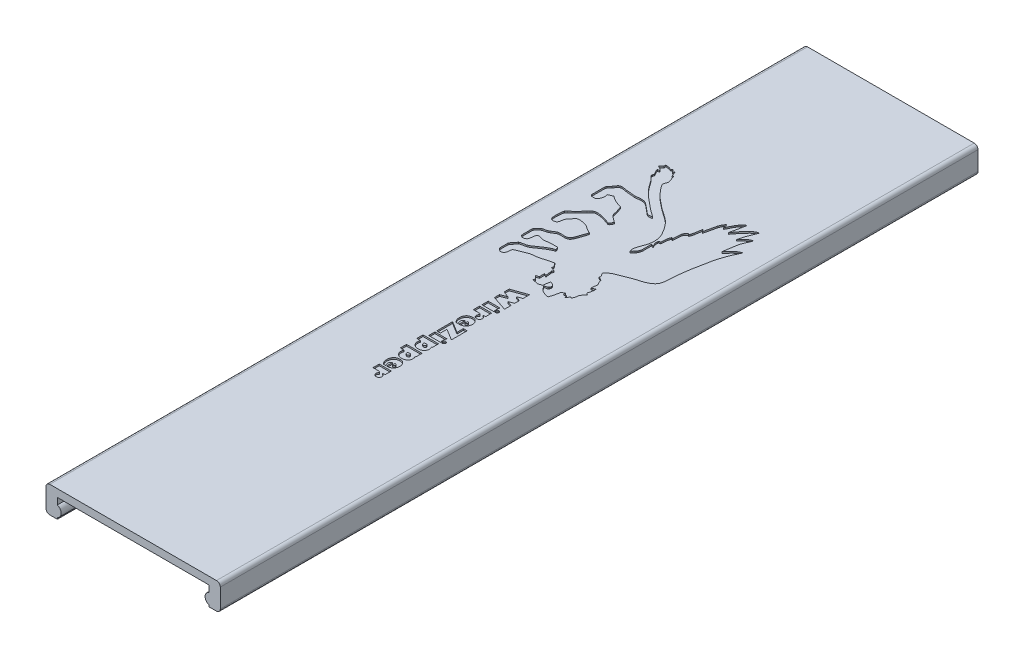
from build123d import *

# Parameters (mm, degrees)
BOSS_EXTRUDE1_DEPTH = 100
CUT_EXTRUDE1_DEPTH  = 0.2
CUT_EXTRUDE3_DEPTH  = 0.2


with BuildPart() as part:
    # Sketch1 → Boss-Extrude1 (new body)
    with BuildSketch(Plane.XY):
        with BuildLine():
            Line((21.5, 0), (22.5, 0))
            ThreePointArc((22.5, 0), (22.853553391, 0.146446609), (23, 0.5))
            Line((23, 0.5), (23, 3))
            ThreePointArc((23, 3), (22.853553391, 3.353553391), (22.5, 3.5))
            Line((22.5, 3.5), (0.5, 3.5))
            ThreePointArc((0.5, 3.5), (0.146446609, 3.353553391), (0, 3))
            Line((0, 3), (0, 0.5))
            ThreePointArc((0, 0.5), (0.146446609, 0.146446609), (0.5, 0))
            Line((0.5, 0), (1.5, 0))
            Line((1.5, 0), (1.5, 0.22281926))
            ThreePointArc((1.5, 0.22281926), (2, 0.929926042), (1.5, 1.637032823))
            Line((1.5, 1.637032823), (1.5, 2.5))
            Line((1.5, 2.5), (21.5, 2.5))
            Line((21.5, 2.5), (21.5, 1.637032823))
            ThreePointArc((21.5, 1.637032823), (21, 0.929926042), (21.5, 0.22281926))
            Line((21.5, 0.22281926), (21.5, 0))
        make_face()
    extrude(amount=BOSS_EXTRUDE1_DEPTH)

    # Sketch2 → Cut-Extrude1 (cut)
    with BuildSketch(Plane(origin=(0, 3.5, -40.204004893), x_dir=(1, 0, 0), z_dir=(0, 1, 0))):
        Polygon((19.745567043, -68.104601105), (19.771329957, -68.016192319), (19.70560115, -68.038746064), (19.64138336, -68.063779757), (19.578619421, -68.091182355), (19.517252165, -68.120842815), (19.457224424, -68.152650096), (19.39847903, -68.186493155), (19.340958816, -68.22226095), (19.284606615, -68.25984244), (19.229365259, -68.299126581), (19.175177579, -68.340002332), (19.12198641, -68.382358651), (19.069734583, -68.426084496), (19.018364931, -68.471068823), (18.918043479, -68.564368759), (18.772748422, -68.710981234), (18.269777505, -69.271361386), (18.281217218, -69.152948654), (18.534959056, -67.569138215), (18.544005901, -67.509503112), (18.554730191, -67.450416977), (18.56703761, -67.391848979), (18.580833842, -67.333768285), (18.612515474, -67.218945481), (18.649020551, -67.105701905), (18.711171581, -66.93825803), (19.047435047, -66.172036884), (19.133726594, -65.94994016), (19.076628488, -65.960005663), (19.0210055, -65.972912087), (18.966794939, -65.988522881), (18.913934115, -66.006701499), (18.862360336, -66.027311391), (18.812010911, -66.05021601), (18.762823149, -66.075278807), (18.71473436, -66.102363235), (18.667681851, -66.131332743), (18.621602933, -66.162050786), (18.576434914, -66.194380813), (18.532115103, -66.228186277), (18.445769342, -66.299677323), (18.362064121, -66.375431536), (18.200569188, -66.535359923), (17.84770658, -66.896305725), (17.884657267, -66.736955957), (17.968344054, -66.421133138), (18.063839559, -66.108907692), (18.225973101, -65.646689184), (18.633040198, -64.666178627), (18.599411796, -64.669771971), (18.533227498, -64.680575674), (18.468456628, -64.695924518), (18.405079291, -64.715485446), (18.312582633, -64.751995932), (18.2231095, -64.796110162), (18.080524168, -64.883478066), (17.794211119, -65.113398916), (17.069099288, -65.909145003), (16.828722484, -66.241607928), (16.513006588, -66.656341035), (16.794160411, -65.369006265), (16.941861286, -64.59631034), (16.870777867, -64.636264025), (16.802816891, -64.679249232), (16.737833191, -64.725113573), (16.675681599, -64.773704659), (16.616216947, -64.824870101), (16.559294067, -64.87845751), (16.504767792, -64.934314498), (16.452492954, -64.992288676), (16.402324385, -65.052227654), (16.354116917, -65.113979045), (16.307725383, -65.177390459), (16.263004615, -65.242309509), (16.219809445, -65.308583804), (16.177994705, -65.376060956), (16.097925845, -65.514014276), (15.98454659, -65.726155966), (15.693970925, -66.293387042), (15.617711182, -66.428936729), (15.54903134, -65.848423204), (15.522460267, -65.865064365), (15.472343148, -65.901302245), (15.426048379, -65.941194805), (15.383322735, -65.984398764), (15.34391299, -66.030570845), (15.290461754, -66.104643271), (15.228435653, -66.210590997), (15.076480483, -66.580017015), (15.040869472, -66.693542611), (14.686293126, -68.258406048), (14.474940792, -67.937489416), (14.445551284, -68.104829917), (14.310577684, -68.947591988), (14.271183579, -69.113223294), (14.240015457, -69.222374291), (14.204192452, -69.330305289), (14.163088355, -69.436841345), (14.140360206, -69.489531601), (14.116076957, -69.541807517), (13.981394714, -69.409464834), (13.758050972, -69.632820298), (13.676716055, -69.754194358), (13.642544144, -69.830846835), (13.624269592, -69.89243466), (13.614813809, -69.932350891), (13.591969798, -70.052722709), (13.568864821, -70.255035201), (13.529664818, -71.070500793), (13.334094675, -70.96058259), (13.302168255, -71.042533388), (13.24802945, -71.209136729), (13.206156478, -71.378791597), (13.169809605, -71.594144463), (13.14752875, -71.855680811), (13.149463132, -72.206015635), (12.963703448, -72.245338409), (12.919499216, -72.274044131), (12.898916729, -72.298983789), (12.888280793, -72.319488077), (12.880455427, -72.34346579), (12.874040289, -72.372947136), (12.865584292, -72.431757942), (12.862523692, -72.490347444), (12.864334122, -72.548693093), (12.870491214, -72.606772342), (12.893747912, -72.722041444), (13.055767611, -73.167952174), (12.76260984, -73.058920113), (12.772836021, -74.2235194), (12.769441063, -74.267985594), (12.764247026, -74.311940293), (12.757306122, -74.355374587), (12.748670559, -74.398279565), (12.738392549, -74.440646318), (12.7265243, -74.482465934), (12.713118023, -74.523729503), (12.698225927, -74.564428116), (12.681900222, -74.604552862), (12.664193119, -74.644094829), (12.624843556, -74.721394791), (12.580594918, -74.796256719), (12.531864882, -74.868609329), (12.479071129, -74.938381339), (12.422631337, -75.005501468), (12.332049001, -75.10105345), (12.235612524, -75.190237731), (12.134731573, -75.272813733), (12.046286421, -74.820815745), (12.0572263, -74.751406038), (12.070060076, -74.682497303), (12.08463885, -74.614050506), (12.100813721, -74.546026613), (12.137356163, -74.411091404), (12.200418082, -74.210884521), (12.455179307, -73.483307548), (12.495149159, -73.349414391), (12.530187067, -73.214246266), (12.545484294, -73.146086506), (12.559101837, -73.077490902), (12.570890798, -73.008420419), (12.580702278, -72.938836025), (12.588387376, -72.868698685), (12.59464246, -72.810642899), (12.603824389, -72.694131792), (12.608519809, -72.577268101), (12.608670092, -72.460267982), (12.604216612, -72.343347591), (12.595100741, -72.226723086), (12.581263852, -72.110610622), (12.562647316, -71.995226355), (12.539192508, -71.880786442), (12.510840798, -71.767507038), (12.47753356, -71.655604302), (12.439212167, -71.545294387), (12.39581799, -71.436793452), (12.347292403, -71.330317652), (12.293576778, -71.226083144), (12.153611462, -70.972593632), (12.055622325, -70.8055721), (11.953676271, -70.640627802), (11.847590064, -70.478189353), (11.737180466, -70.318685371), (11.622264242, -70.162544472), (11.563058883, -70.085869122), (11.502658155, -70.010195274), (11.441039151, -69.935576505), (11.378178968, -69.862066392), (11.314054701, -69.789718512), (11.248643446, -69.718586443), (11.181922298, -69.648723762), (11.113868352, -69.580184045), (11.044458704, -69.513020869), (10.973670449, -69.447287813), (10.901480682, -69.383038452), (10.8278665, -69.320326365), (10.752804998, -69.259205127), (10.676273271, -69.199728316), (10.598248414, -69.14194951), (10.518707523, -69.085922285), (9.445158783, -68.330045283), (9.377323265, -68.286704215), (8.529964041, -67.61150044), (8.336111467, -67.454739788), (8.147528972, -67.291868199), (7.90408908, -67.065842996), (7.669551492, -66.830496664), (7.443649508, -66.586710778), (7.173009545, -66.271453322), (6.864769026, -65.879980377), (6.709729802, -65.656858788), (6.656644684, -65.543795663), (6.640724685, -65.474324633), (6.637953976, -65.419306649), (6.637039488, -65.393399508), (6.637876621, -65.367752405), (6.640315856, -65.342344663), (6.649402561, -65.292164545), (6.663103453, -65.24269372), (6.767484106, -64.975890107), (6.787730528, -64.902361955), (6.795283594, -64.852609955), (6.796828208, -64.827451949), (6.796685517, -64.802078367), (6.794706002, -64.77646853), (6.790740146, -64.75060176), (6.78463843, -64.724457376), (6.776251336, -64.698014701), (6.478949583, -63.833852049), (6.316198754, -63.871944585), (6.081407246, -63.266668763), (5.943714714, -63.442255947), (5.617870925, -63.080333737), (5.499302591, -63.247135679), (5.418185032, -63.212665539), (5.083167801, -63.109789756), (4.852038362, -63.078852692), (4.675548278, -63.079290725), (4.667182278, -63.332341528), (4.3028609, -63.683744915), (4.436380901, -63.74543469), (4.682235799, -63.862000094), (4.740558774, -63.903978471), (4.775654331, -63.93618192), (4.807122862, -63.972386928), (4.821336845, -63.992158035), (4.834451894, -64.013131153), (4.846403949, -64.035373491), (4.857128952, -64.058952255), (4.866562843, -64.083934652), (4.619415738, -64.138096574), (4.636424293, -64.21830065), (4.696572924, -64.397852828), (4.954743423, -64.842439101), (4.882509129, -65.057092669), (4.880850914, -65.175763412), (4.901269108, -65.22048276), (4.962643763, -65.325273315), (5.32889596, -65.714175511), (5.354305854, -65.737196295), (5.426177903, -65.809786685), (5.534157903, -65.940347595), (5.924220438, -66.497400316), (5.994118086, -66.591179891), (6.065464319, -66.683663429), (6.138209009, -66.774888771), (6.212302028, -66.86489376), (6.287693249, -66.953716237), (6.364332545, -67.041394044), (6.442169787, -67.127965023), (6.521154849, -67.213467015), (6.601237603, -67.297937861), (6.764495676, -67.463937487), (6.931542986, -67.626266632), (7.101978513, -67.785228032), (7.275401236, -67.94112442), (7.540259084, -68.169884333), (8.356211579, -68.829090573), (8.39965809, -68.870721216), (8.488690302, -68.951152824), (8.626852738, -69.065704523), (8.914944993, -69.279321314), (9.595664905, -69.767475131), (9.73351794, -69.882958951), (9.238387712, -69.912079265), (9.122579566, -69.898059871), (9.054333719, -69.880159565), (8.905920839, -69.767554214), (7.90154777, -68.93355232), (7.651348823, -68.749684369), (7.602203888, -68.718777787), (7.552316259, -68.691274341), (7.501727456, -68.667008821), (7.450479005, -68.645816018), (7.398612426, -68.627530719), (7.346169242, -68.611987715), (7.293190978, -68.599021796), (7.239719154, -68.588467749), (7.185795294, -68.580160366), (7.13146092, -68.573934435), (7.076757555, -68.569624746), (7.021726722, -68.567066089), (6.910848742, -68.566541025), (6.743113827, -68.5747559), (6.185203457, -68.626466799), (6.076335393, -68.631387665), (4.991956592, -68.53259847), (4.861058435, -68.514729341), (4.366578875, -68.439300904), (4.267682616, -68.437779177), (4.201866854, -68.441828587), (4.136175391, -68.450643686), (4.070635862, -68.464836967), (4.037931708, -68.474141829), (4.01404608, -68.482781016), (3.991237496, -68.492646738), (3.969449153, -68.503673451), (3.92870599, -68.528947679), (3.891362185, -68.558079357), (3.856963332, -68.590544139), (3.780868317, -68.68284742), (3.574977655, -68.983157009), (3.510176489, -69.065065577), (3.25557439, -69.337636123), (3.211351075, -69.401747679), (3.186726578, -69.44712548), (3.166822765, -69.495060225), (3.158864646, -69.520106327), (3.152354934, -69.545935514), (3.147383041, -69.572595737), (3.14403838, -69.600134946), (3.139952782, -69.65652541), (3.140584749, -71.23861477), (3.144107239, -71.277524794), (3.183718199, -71.405349389), (3.229265505, -71.469694649), (3.269232129, -71.502636865), (3.304427669, -71.520476277), (3.344216436, -71.53134745), (3.61837653, -71.551970824), (3.709675015, -71.543297562), (3.775331899, -71.528081984), (3.817132856, -71.512976279), (3.856966272, -71.493394454), (3.894496742, -71.468902338), (3.91229356, -71.454679244), (3.929388866, -71.439065763), (3.945740734, -71.422007625), (3.961307239, -71.403450559), (3.98937849, -71.373627764), (4.015892902, -71.342811256), (4.040860808, -71.311051795), (4.064292537, -71.278400145), (4.086198421, -71.244907065), (4.106588791, -71.210623319), (4.125473977, -71.175599669), (4.142864311, -71.139886875), (4.158770122, -71.1035357), (4.173201743, -71.066596906), (4.186169503, -71.029121254), (4.197683734, -70.991159506), (4.207754767, -70.952762424), (4.216392932, -70.91398077), (4.223608561, -70.874865306), (4.233813531, -70.795835993), (4.238452325, -70.71608058), (4.237607589, -70.636005163), (4.23136197, -70.556015834), (4.219798116, -70.476518688), (4.202998672, -70.397919821), (4.181046286, -70.320625326), (4.790131131, -70.048376237), (5.224468095, -70.346633618), (5.475077196, -70.486742868), (5.64836071, -70.567299985), (5.78185668, -70.619673541), (5.91856101, -70.664295823), (6.011559556, -70.689357225), (6.441244971, -70.804155975), (6.680255914, -71.473471612), (6.700440152, -71.528410734), (6.744214516, -71.698966386), (6.8305612, -72.101378224), (6.861817271, -72.18289268), (6.887686976, -72.235415575), (6.918328723, -72.286218549), (6.970050687, -72.344544556), (7.108551306, -72.480415089), (7.793872115, -72.991890375), (7.735132038, -73.15174023), (7.645154274, -73.31873513), (7.592514427, -73.38335033), (7.546532614, -73.426319923), (7.494231265, -73.463718165), (7.455521087, -73.485171093), (6.985274076, -73.317712497), (6.413893192, -73.140189722), (6.218812671, -73.098385977), (6.070290228, -73.075536206), (6.002042209, -73.066146668), (5.611704265, -73.021744922), (5.505306074, -73.022135986), (5.435448501, -73.027843033), (5.366821867, -73.038771649), (5.333069605, -73.046425607), (5.299744422, -73.055662833), (5.266886098, -73.06657595), (5.234534417, -73.079257584), (5.202729158, -73.093800359), (5.171510104, -73.110296901), (5.140917036, -73.128839834), (5.110989736, -73.149521784), (5.081767984, -73.172435374), (5.038848794, -73.208166122), (4.914287773, -73.319608788), (4.718279149, -73.517061407), (3.986003167, -74.357903796), (3.433483796, -74.798544394), (3.243243612, -74.988383245), (3.204221159, -75.132149523), (3.132588262, -75.845942829), (3.130799477, -76.252818038), (3.148654304, -76.422002715), (3.168852255, -76.521067461), (3.187151588, -76.585602228), (3.209812025, -76.648656325), (3.237256891, -76.709994933), (3.269909511, -76.769383233), (3.288321017, -76.798272638), (3.329155607, -76.818994217), (3.393163804, -76.84288409), (3.45976748, -76.858628273), (3.551225161, -76.86789309), (3.643973908, -76.864941433), (3.781363878, -76.840439001), (3.931373466, -76.786619478), (3.950191496, -76.76983757), (3.967597017, -76.752250032), (3.983658702, -76.733899947), (4.012025244, -76.695084471), (4.035840485, -76.653735812), (4.055653791, -76.610198638), (4.085472057, -76.517937421), (4.154540692, -76.130285695), (4.157762673, -76.099856406), (4.162628318, -76.070279244), (4.169049296, -76.041508503), (4.176937276, -76.013498481), (4.196760928, -75.959577778), (4.221392631, -75.908151502), (4.265809513, -75.834889324), (4.488060664, -75.565058469), (4.592547696, -75.426797706), (4.768640496, -75.176910233), (4.823399979, -75.126278587), (4.869821171, -75.095667931), (4.903789049, -75.079559916), (4.940466976, -75.067384508), (4.98010671, -75.059564567), (5.021954842, -75.04726225), (5.063804833, -75.037016268), (5.105652668, -75.028734313), (5.147494334, -75.022324076), (5.189325817, -75.017693247), (5.231143104, -75.014749518), (5.272942181, -75.01340058), (5.314719033, -75.013554125), (5.398190011, -75.017999424), (5.481523927, -75.027346945), (5.606197568, -75.048944486), (6.179790772, -75.200372854), (6.239633866, -75.219128046), (6.296962677, -75.242394957), (6.379011919, -75.284391349), (6.533269842, -75.386216596), (6.862349187, -75.617843215), (6.945037614, -75.659721778), (7.352869278, -75.847349819), (7.335319283, -75.927703013), (7.254192511, -76.202650419), (6.985260636, -76.976985108), (6.921800835, -77.174822227), (6.841723584, -77.37132666), (6.79270217, -77.464611689), (6.755947017, -77.523748635), (6.715552076, -77.579825402), (6.671191275, -77.632312519), (6.647421778, -77.657044497), (6.622538539, -77.680680511), (6.596500797, -77.703154375), (6.569267795, -77.724399905), (6.540798772, -77.744350918), (6.511052969, -77.76294123), (6.479989628, -77.780104655), (6.447567989, -77.795775011), (6.40560176, -77.808651938), (6.363432271, -77.819535485), (6.321073302, -77.828565942), (6.278538629, -77.835883599), (6.235842032, -77.841628747), (6.150018177, -77.848962676), (6.020412416, -77.85167701), (5.541917787, -77.834166794), (5.41216609, -77.838595989), (5.326210196, -77.84748146), (5.283437156, -77.854124869), (5.240819091, -77.862422447), (5.198369779, -77.872514485), (5.142932417, -77.892932147), (5.037240988, -77.94319646), (4.595508909, -78.232665262), (4.465771592, -78.301295382), (4.414079725, -78.328559934), (4.360843257, -78.35123264), (4.250771412, -78.385854041), (3.854897238, -78.474529346), (3.773689965, -78.503975684), (3.721286266, -78.528674252), (3.670571997, -78.55831699), (3.616155246, -78.595331521), (3.217410772, -79.00059091), (3.19317992, -79.036269035), (3.173696418, -79.073379124), (3.152297456, -79.131367032), (3.135794606, -79.212150909), (3.130301383, -79.59056065), (3.131677235, -79.625378652), (3.13515924, -80.361202792), (3.153164243, -80.499456743), (3.175475562, -80.602089762), (3.194897118, -80.632702863), (3.216551099, -80.660694146), (3.240262865, -80.686093336), (3.265857778, -80.70893016), (3.2931612, -80.729234343), (3.32199849, -80.747035611), (3.35219501, -80.762363689), (3.383576122, -80.775248304), (3.415967186, -80.785719181), (3.449193564, -80.793806045), (3.483080616, -80.799538623), (3.517453704, -80.80294664), (3.552138188, -80.804059822), (3.586959431, -80.802907895), (3.621742792, -80.799520584), (3.656313633, -80.793927616), (3.690497316, -80.786158715), (3.724119201, -80.776243608), (3.757004649, -80.76421202), (3.788979022, -80.750093677), (3.819867681, -80.733918305), (3.849495986, -80.71571563), (3.877689299, -80.695515377), (3.90427298, -80.673347272), (3.929072392, -80.649241041), (3.951912895, -80.62322641), (3.97261985, -80.595333103), (3.991018618, -80.565590848), (4.006934561, -80.534029369), (4.026658772, -80.468509876), (4.041958321, -80.401577975), (4.093602475, -79.987461307), (4.118134233, -79.851994599), (4.136012084, -79.786120475), (4.158887552, -79.72189382), (4.17249384, -79.690493915), (4.187702868, -79.659620623), (4.204632414, -79.629312193), (4.223400257, -79.599606872), (4.244124176, -79.57054291), (4.294322886, -79.560046044), (4.394477249, -79.549496262), (4.519018866, -79.553175896), (4.956959152, -79.660275724), (4.993137986, -79.67044278), (5.029338755, -79.678827737), (5.06556032, -79.685532985), (5.10180154, -79.690660915), (5.138061278, -79.694313918), (5.210631748, -79.697604709), (5.283262616, -79.696224487), (5.392302227, -79.687187846), (5.901775676, -79.611653552), (6.010888162, -79.605724838), (6.910724574, -79.583092112), (7.079993608, -79.979697301), (6.960640786, -80.018349236), (6.843254235, -80.061514076), (6.727725219, -80.108861548), (6.557676714, -80.187002723), (6.391196025, -80.272697043), (6.17413742, -80.396778888), (5.497482708, -80.847161933), (5.050235161, -81.163132955), (4.845481788, -81.276636507), (4.702724052, -81.339200331), (4.591832195, -81.377593303), (4.515905719, -81.398582916), (3.962451456, -81.509870343), (3.836287705, -81.55399255), (3.763557986, -81.589752309), (3.421766696, -82.024454199), (3.230115071, -82.262994818), (3.189620962, -82.341215118), (3.174230893, -82.391897064), (3.168589007, -82.427579253), (3.16714966, -82.464962643), (3.169082441, -83.369377327), (3.171152539, -83.404791173), (3.176253231, -83.439743518), (3.184234647, -83.474111917), (3.194946916, -83.507773927), (3.208240169, -83.540607104), (3.223964534, -83.572489007), (3.241970142, -83.60329719), (3.262107121, -83.632909211), (3.284225601, -83.661202627), (3.308175713, -83.688054993), (3.333807585, -83.713343867), (3.360971347, -83.736946806), (3.389517129, -83.758741365), (3.41929506, -83.778605102), (3.45015527, -83.796415573), (3.481947888, -83.812050335), (3.514523044, -83.825386944), (3.547730868, -83.836302957), (3.581421489, -83.844675931), (3.615445037, -83.850383422), (3.649651641, -83.853302987), (3.683891431, -83.853312183), (3.718014536, -83.850288566), (3.751871086, -83.844109693), (3.785311211, -83.834653121), (3.81818504, -83.821796405), (3.850342703, -83.805417104), (3.881634329, -83.785392772), (3.911910048, -83.761600968), (3.941627115, -83.738549129), (3.968555703, -83.714125817), (3.992849747, -83.688409762), (4.014663184, -83.66147969), (4.034149948, -83.633414329), (4.051463973, -83.604292407), (4.066759197, -83.574192652), (4.080189553, -83.543193792), (4.091908977, -83.511374553), (4.102071403, -83.478813665), (4.110830768, -83.445589854), (4.124756052, -83.377468376), (4.162536714, -83.023853064), (4.178529719, -82.921216849), (4.194234668, -82.855645098), (4.204061831, -82.823951123), (5.709166827, -82.208816781), (5.745468392, -82.195717217), (5.818706943, -82.173175852), (5.929944577, -82.147271155), (6.156009482, -82.115763661), (6.687170783, -82.058997138), (6.798940154, -82.033761003), (6.921100642, -82.008515318), (7.102783459, -81.963377734), (7.942165958, -81.715913405), (8.123883521, -81.672704643), (8.246073986, -81.64912304), (8.369302006, -81.630693129), (8.431358997, -81.623670497), (8.493740054, -81.618248314), (8.556466735, -81.614530755), (8.872641196, -82.023266092), (8.847383583, -82.360020721), (9.365290519, -82.508550236), (9.235963053, -82.755180236), (9.30174099, -82.920386313), (9.291343064, -82.965881161), (9.283217409, -83.033851223), (9.283864284, -83.124082108), (9.357134099, -83.57422359), (9.058292573, -83.474445045), (9.070313767, -84.164851175), (8.674314613, -84.279138404), (9.075376023, -84.693660343), (9.004267543, -84.946211574), (9.797893144, -85.091875963), (10.299309972, -84.918726798), (10.302590804, -84.888892866), (10.362134706, -84.257198502), (10.392402408, -84.140493295), (10.4238157, -84.054795842), (10.452761583, -84.053395865), (10.48270627, -84.054232149), (10.513454488, -84.057230867), (10.544810964, -84.062318192), (10.576580425, -84.069420299), (10.608567599, -84.078463359), (10.640577212, -84.089373546), (10.672413991, -84.102077034), (10.703882664, -84.116499996), (10.734787958, -84.132568605), (10.764934599, -84.150209034), (10.794127315, -84.169347457), (10.822170833, -84.189910047), (10.84886988, -84.211822978), (10.874029183, -84.235012421), (10.897453468, -84.259404552), (10.918947464, -84.284925543), (10.938315897, -84.311501567), (10.955363494, -84.339058797), (10.969894983, -84.367523408), (10.98171509, -84.396821571), (10.990628542, -84.426879461), (10.996440067, -84.457623251), (10.998954391, -84.488979114), (10.997976242, -84.520873223), (10.993310347, -84.553231752), (10.984761433, -84.585980873), (10.972134227, -84.619046761), (10.955233455, -84.652355588), (10.946900708, -84.675901271), (10.937122571, -84.697505549), (10.925975944, -84.717267722), (10.913537725, -84.735287091), (10.899884813, -84.751662955), (10.885094105, -84.766494615), (10.869242501, -84.779881371), (10.852406898, -84.791922524), (10.834664196, -84.802717374), (10.796765085, -84.820965366), (10.735035629, -84.841472587), (10.468766526, -84.891767434), (10.407742715, -84.909813177), (10.632654551, -85.215101293), (10.856289859, -85.482768493), (10.94391904, -85.559685488), (11.007478361, -85.597529103), (11.238912997, -85.713053186), (11.51691899, -85.814885234), (11.949543592, -85.913752266), (12.142914428, -85.340516337), (12.268622202, -84.704727993), (12.270172263, -84.682613028), (12.273394104, -84.661654343), (12.278202913, -84.641799733), (12.284513875, -84.622996995), (12.292242176, -84.605193922), (12.301303003, -84.588338312), (12.32308298, -84.55726066), (12.349175294, -84.529346403), (12.378901438, -84.504177905), (12.428819842, -84.470659881), (12.682407584, -84.342088626), (12.736615276, -84.712836608), (13.058275473, -84.546878528), (13.138678392, -84.839029217), (13.15619516, -84.830826961), (13.188655655, -84.812000098), (13.231520718, -84.778313524), (13.27949892, -84.724938588), (13.440817098, -84.41633767), (13.632120999, -84.500552553), (13.75384145, -84.259790443), (13.818074028, -84.056258307), (13.84273201, -83.897648818), (13.845714599, -83.761784673), (13.855415492, -83.734454161), (13.889406923, -83.655010608), (13.944616533, -83.554313431), (14.320152096, -83.076569037), (14.06605127, -82.885197209), (14.098786875, -82.818870429), (14.141116363, -82.717192121), (14.175841778, -82.613213385), (14.211333893, -82.471629225), (14.244252884, -82.254702703), (14.255583412, -81.85169457), (13.769921082, -82.077886878), (13.767131001, -81.988319314), (13.774855998, -81.869942166), (13.859551467, -81.343553664), (13.863599826, -81.226018561), (13.63271354, -80.803171682), (13.598279053, -80.702891724), (13.581417493, -80.624274459), (13.575291626, -80.569914619), (13.573784579, -80.513793389), (13.044000725, -80.267249877), (13.143231585, -80.107359869), (12.879349072, -79.691964097), (12.846268149, -79.593671721), (12.895346802, -79.536538831), (13.133480095, -79.294607686), (13.308790367, -79.152128919), (13.465607452, -79.048500383), (13.598379918, -78.977255637), (13.702367947, -78.93144955), (15.214345303, -78.327294979), (15.618309027, -78.185406688), (15.863997926, -78.109643113), (16.029493375, -78.063956105), (16.35909275, -77.961655427), (16.624715944, -77.868975237), (16.755920195, -77.817254558), (16.884959432, -77.761089918), (16.948410893, -77.731140275), (17.011013567, -77.699838637), (17.072664943, -77.667104669), (17.13326251, -77.632858035), (17.192703758, -77.597018403), (17.250886175, -77.559505435), (17.307707249, -77.520238797), (17.363064471, -77.479138156), (17.416855329, -77.436123174), (17.468977312, -77.391113518), (17.519327909, -77.344028853), (17.567804609, -77.294788844), (17.614304901, -77.243313156), (17.658726274, -77.189521454), (17.700966217, -77.133333402), (17.740922218, -77.074668667), (17.768709081, -77.008887079), (17.794040451, -76.942566934), (17.817040611, -76.87573761), (17.837833847, -76.808428488), (17.856544442, -76.740668949), (17.873296682, -76.672488371), (17.888214851, -76.603916135), (17.901423233, -76.534981622), (17.913046113, -76.46571421), (17.923207776, -76.396143281), (17.939644586, -76.256208387), (17.95172794, -76.115411982), (17.984800059, -75.336135569), (18.0039464, -75.055702584), (18.21790855, -73.436569234), (18.646280749, -71.241641808), (18.668328165, -71.098314098), (18.694877755, -70.956082083), (18.74224461, -70.744591426), (18.817321843, -70.465598008), (19.238999652, -69.233892702), (19.288145915, -69.10518097), (19.568730961, -68.526840663), (19.699700683, -68.234226031), align=None)
    extrude(amount=-CUT_EXTRUDE1_DEPTH, mode=Mode.SUBTRACT)

    # Sketch4 → Cut-Extrude3 (cut)
    # profile 1 of 12: a face of its own
    with BuildSketch(Plane(origin=(0, 3.5, 0), x_dir=(1, 0, 0), z_dir=(0, 1, 0))):
        Polygon((8.493740054, -48.034946546), (8.493740054, -47.377524671), (10.493740054, -46.664243421), (10.493740054, -47.536118421), (9.841005679, -47.770493421), (10.493740054, -48.016587171), (10.493740054, -48.636899671), (9.841005679, -48.895102796), (10.493740054, -49.115805921), (10.493740054, -49.989243421), (8.493740054, -49.309165296), (8.493740054, -48.650180921), (9.290224429, -48.331430921), align=None)
    # profile 2 of 12: a face of its own
    with BuildSketch(Plane(origin=(0, 3.5, 0), x_dir=(1, 0, 0), z_dir=(0, 1, 0))):
        with BuildLine():
            add(Edge.make_bspline(
                [(10.068740054, -50.735337171), (10.069574094, -50.720406186), (10.071221442, -50.690915359), (10.084096682, -50.648534127), (10.105515009, -50.609567277), (10.13462238, -50.57505662), (10.169201583, -50.545802608), (10.208321787, -50.524711534), (10.250593047, -50.511576494), (10.279973554, -50.509978028), (10.294911929, -50.509165296)],
                knots=[0, 0, 0, 0, 1.009378599, 1.993666835, 2.967841641, 4.000348654, 5.032855666, 6.014773643, 6.990621401, 8, 8, 8, 8], degree=3))
            add(Edge.make_bspline(
                [(10.294911929, -50.509165296), (10.309849642, -50.509980809), (10.339228849, -50.511584744), (10.381399294, -50.524645551), (10.420219205, -50.545708915), (10.454044033, -50.575219128), (10.482824898, -50.609559791), (10.503671884, -50.648645795), (10.516771828, -50.690881644), (10.518078671, -50.720398778), (10.518740054, -50.735337171)],
                knots=[0, 0, 0, 0, 1.0134126, 1.993160351, 2.971228465, 3.994329448, 5.02532064, 5.999176987, 6.98739895, 8, 8, 8, 8], degree=3))
            add(Edge.make_bspline(
                [(10.518740054, -50.735337171), (10.518096824, -50.750281605), (10.516831235, -50.779685609), (10.503555018, -50.821721344), (10.48303268, -50.860619191), (10.454017161, -50.894361879), (10.419966038, -50.922932867), (10.381495659, -50.944220634), (10.339148091, -50.956615161), (10.309834932, -50.958305012), (10.294911929, -50.959165296)],
                knots=[0, 0, 0, 0, 1.017177303, 2.001352833, 2.979610333, 4.001591882, 5.017875578, 6.00036388, 6.98200748, 8, 8, 8, 8], degree=3))
            add(Edge.make_bspline(
                [(10.294911929, -50.959165296), (10.279988196, -50.958307834), (10.250673605, -50.956623526), (10.208225618, -50.944155991), (10.169452081, -50.92283492), (10.134654283, -50.894523075), (10.105305336, -50.860614868), (10.084214637, -50.821832281), (10.071160977, -50.779652076), (10.069556064, -50.750274205), (10.068740054, -50.735337171)],
                knots=[0, 0, 0, 0, 1.013893472, 1.991584386, 2.977894406, 4.003775212, 5.027361664, 6.005893879, 6.986106528, 8, 8, 8, 8], degree=3))
        make_face()
    # profile 3 of 12: a face of its own
    with BuildSketch(Plane(origin=(0, 3.5, 0), x_dir=(1, 0, 0), z_dir=(0, 1, 0))):
        with BuildLine():
            Line((10.093740054, -50.964243421), (8.493740054, -50.964243421))
            Line((8.493740054, -50.964243421), (8.493740054, -50.139243421))
            Line((8.493740054, -50.139243421), (10.093740054, -50.139243421))
            add(Edge.make_bspline(
                [(10.093740054, -50.139243421), (10.085669549, -50.153171115), (10.069295049, -50.181429452), (10.049184388, -50.227059106), (10.032035076, -50.275521742), (10.017889582, -50.327079446), (10.007110167, -50.381665319), (9.999370507, -50.439193898), (9.994569345, -50.499708424), (9.994021421, -50.541057129), (9.993740054, -50.562290296)],
                knots=[0, 0, 0, 0, 0.877200649, 1.779780104, 2.71397693, 3.67857263, 4.692272687, 5.74560382, 6.842334481, 8, 8, 8, 8], degree=3))
            add(Edge.make_bspline(
                [(9.993740054, -50.562290296), (9.994027934, -50.581961476), (9.994593104, -50.62058013), (9.999394978, -50.677321118), (10.007086156, -50.731609073), (10.017982965, -50.783310557), (10.032089363, -50.832398306), (10.04923681, -50.878912135), (10.069486362, -50.923027165), (10.085692482, -50.950567533), (10.093740054, -50.964243421)],
                knots=[0, 0, 0, 0, 1.124996517, 2.208604206, 3.254495079, 4.25946492, 5.228266681, 6.173185239, 7.092847464, 8, 8, 8, 8], degree=3))
        make_face()
    # profile 4 of 12: a face of its own
    with BuildSketch(Plane(origin=(0, 3.5, 0), x_dir=(1, 0, 0), z_dir=(0, 1, 0))):
        with BuildLine():
            add(Edge.make_bspline(
                [(9.745693179, -52.089243421), (9.760875817, -52.095714418), (9.790525967, -52.108351617), (9.832696352, -52.129732828), (9.872297627, -52.151350943), (9.908739612, -52.174570041), (9.942416438, -52.198638618), (9.973011111, -52.22419026), (10.000731026, -52.25063812), (10.025571869, -52.278170558), (10.047513946, -52.306774823), (10.066802531, -52.336447902), (10.082797829, -52.367360535), (10.095873764, -52.399395271), (10.105886237, -52.432513603), (10.113443129, -52.46656821), (10.117781303, -52.501761751), (10.118416521, -52.525559908), (10.118740054, -52.537680921)],
                knots=[0, 0, 0, 0, 1.272947967, 2.485937938, 3.646070252, 4.752461798, 5.817491216, 6.837459618, 7.825055744, 8.771109415, 9.695364672, 10.603761161, 11.49788128, 12.376517629, 13.269451874, 14.164023341, 15.064889935, 16, 16, 16, 16], degree=3))
            add(Edge.make_bspline(
                [(10.118740054, -52.537680921), (10.118477903, -52.551107482), (10.117964331, -52.57741103), (10.112819734, -52.615906612), (10.104028082, -52.652437086), (10.092646022, -52.687520756), (10.076493253, -52.72024276), (10.058420284, -52.751978486), (10.03583506, -52.781142344), (10.010495979, -52.808494552), (9.982661173, -52.833263634), (9.952624308, -52.855095081), (9.920732868, -52.873285419), (9.887001835, -52.888395376), (9.851537136, -52.900098142), (9.814078804, -52.908171638), (9.77488368, -52.913507699), (9.748055172, -52.913994841), (9.734365054, -52.914243421)],
                knots=[0, 0, 0, 0, 1.068321857, 2.092915352, 3.083392302, 4.056803988, 5.021068689, 5.982711963, 6.959043587, 7.949086641, 8.947502873, 9.919810416, 10.899382301, 11.864370819, 12.857447167, 13.865819438, 14.91096497, 16, 16, 16, 16], degree=3))
            add(Edge.make_bspline(
                [(9.734365054, -52.914243421), (9.720155493, -52.91399092), (9.692291869, -52.91349579), (9.651656929, -52.908222835), (9.613083737, -52.900079776), (9.576596981, -52.888702235), (9.541937001, -52.874286571), (9.509517784, -52.856239175), (9.479071804, -52.834979026), (9.451273383, -52.81040425), (9.425675316, -52.783610249), (9.403907247, -52.754206675), (9.385250927, -52.722961424), (9.370067293, -52.689822795), (9.358269305, -52.654578491), (9.349696951, -52.617448142), (9.344507359, -52.578192917), (9.343999305, -52.551368799), (9.343740054, -52.537680921)],
                knots=[0, 0, 0, 0, 1.116703655, 2.189751872, 3.215862479, 4.213223321, 5.190572813, 6.162113662, 7.124984703, 8.104476803, 9.074992165, 10.033280158, 10.974405702, 11.931872986, 12.893436813, 13.891795567, 14.924220135, 16, 16, 16, 16], degree=3))
            add(Edge.make_bspline(
                [(9.343740054, -52.537680921), (9.344212327, -52.522032924), (9.345145432, -52.49111603), (9.351915209, -52.445532091), (9.363169536, -52.401613793), (9.379359773, -52.359641862), (9.399913888, -52.31931822), (9.424979233, -52.280773714), (9.45429356, -52.243614602), (9.477075318, -52.22129706), (9.488661929, -52.209946546)],
                knots=[0, 0, 0, 0, 1.017403478, 2.010158639, 2.989826744, 3.96011806, 4.929596148, 5.927825441, 6.946109499, 8, 8, 8, 8], degree=3))
            add(Edge.make_bspline(
                [(9.488661929, -52.209946546), (9.479451162, -52.200242712), (9.46051815, -52.180296185), (9.425491339, -52.155912359), (9.385110625, -52.135131398), (9.339089, -52.117988086), (9.287333762, -52.104940928), (9.229958726, -52.095692598), (9.167018132, -52.090366214), (9.123177561, -52.089627532), (9.100380679, -52.089243421)],
                knots=[0, 0, 0, 0, 0.765417932, 1.573339815, 2.431436092, 3.364572883, 4.382128498, 5.486659779, 6.693075379, 8, 8, 8, 8], degree=3))
            Line((9.100380679, -52.089243421), (8.493740054, -52.089243421))
            Line((8.493740054, -52.089243421), (8.493740054, -51.264243421))
            Line((8.493740054, -51.264243421), (10.093740054, -51.264243421))
            Line((10.093740054, -51.264243421), (10.093740054, -52.089243421))
            Line((10.093740054, -52.089243421), (9.745693179, -52.089243421))
        make_face()
    # profile 5 of 12: a face of its own
    with BuildSketch(Plane(origin=(0, 3.5, 0), x_dir=(1, 0, 0), z_dir=(0, 1, 0))):
        with BuildLine():
            Line((9.118740054, -54.689243421), (8.831240054, -54.689243421))
            add(Edge.make_bspline(
                [(8.831240054, -54.689243421), (8.816513997, -54.678093481), (8.78729212, -54.655967925), (8.746264628, -54.61986536), (8.708034716, -54.581936517), (8.672251809, -54.542536125), (8.639788609, -54.500903581), (8.610132397, -54.457535435), (8.583050088, -54.412448894), (8.558705477, -54.365567661), (8.537776305, -54.316623643), (8.519267177, -54.266060322), (8.503770915, -54.213715772), (8.49069124, -54.159656943), (8.481088228, -54.103646617), (8.474082872, -54.045764699), (8.469700637, -53.986055129), (8.469062752, -53.945631012), (8.468740054, -53.925180921)],
                knots=[0, 0, 0, 0, 1.006935666, 1.998128321, 2.977141687, 3.942387175, 4.89826482, 5.853403846, 6.80560914, 7.764619567, 8.731404501, 9.706212254, 10.699107226, 11.706543407, 12.737254108, 13.795809263, 14.88492557, 16, 16, 16, 16], degree=3))
            add(Edge.make_bspline(
                [(8.468740054, -53.925180921), (8.469335451, -53.89168333), (8.470497191, -53.826322883), (8.481879251, -53.730852792), (8.499469091, -53.640305976), (8.524999971, -53.554805007), (8.557435641, -53.474295903), (8.597142208, -53.398736199), (8.644033251, -53.328105096), (8.698464504, -53.263455986), (8.758310612, -53.204985746), (8.823144645, -53.153734782), (8.892722991, -53.110490934), (8.966928597, -53.075260694), (9.045628234, -53.047731099), (9.128911788, -53.028354146), (9.216827479, -53.016353093), (9.277034141, -53.014956927), (9.307802554, -53.014243421)],
                knots=[0, 0, 0, 0, 1.152387093, 2.248535895, 3.304029504, 4.323442358, 5.314538336, 6.286721634, 7.256164124, 8.226403797, 9.189778641, 10.131107738, 11.064983361, 12.003064201, 12.952623945, 13.928713741, 14.941476128, 16, 16, 16, 16], degree=3))
            add(Edge.make_bspline(
                [(9.307802554, -53.014243421), (9.337005899, -53.01485595), (9.394323985, -53.016058175), (9.478132278, -53.027351357), (9.557818608, -53.045171204), (9.633422784, -53.070237634), (9.704768428, -53.102771728), (9.771968142, -53.142573068), (9.835302051, -53.189169884), (9.893393604, -53.243134562), (9.946747115, -53.302045626), (9.992305552, -53.366668029), (10.031924884, -53.434778703), (10.063485713, -53.507804571), (10.088659355, -53.584771953), (10.106011031, -53.666220315), (10.116841722, -53.751710208), (10.1180984, -53.810173563), (10.118740054, -53.840024671)],
                knots=[0, 0, 0, 0, 1.077444665, 2.114725699, 3.115107956, 4.087802924, 5.049187725, 6.003688223, 6.965901592, 7.945506269, 8.925770961, 9.894003046, 10.858542198, 11.829168939, 12.824690449, 13.842799004, 14.89854357, 16, 16, 16, 16], degree=3))
            add(Edge.make_bspline(
                [(10.118740054, -53.840024671), (10.118005138, -53.870659677), (10.116557897, -53.930987999), (10.104623368, -54.019854027), (10.084546221, -54.105163025), (10.057491398, -54.187004983), (10.022150877, -54.26421502), (9.979492067, -54.336477671), (9.929168481, -54.403291731), (9.871776923, -54.46404303), (9.80845592, -54.518445275), (9.739794954, -54.565660698), (9.665946625, -54.604783843), (9.586654519, -54.636563726), (9.500384192, -54.660217238), (9.406032087, -54.677317503), (9.302808466, -54.687292663), (9.231001854, -54.68857697), (9.193740054, -54.689243421)],
                knots=[0, 0, 0, 0, 1.03365245, 2.035531405, 3.019408884, 3.988014655, 4.939806357, 5.879632809, 6.814793446, 7.756754517, 8.694812135, 9.62729463, 10.563074592, 11.509688361, 12.504497063, 13.576765824, 14.742538237, 16, 16, 16, 16], degree=3))
            Line((9.193740054, -54.689243421), (9.193740054, -53.888071546))
            add(Edge.make_bspline(
                [(9.193740054, -53.888071546), (9.174937677, -53.895926339), (9.138070129, -53.911327954), (9.088516651, -53.944735815), (9.044961388, -53.984795679), (9.008785849, -54.032335369), (8.979991665, -54.084954451), (8.958933405, -54.141753516), (8.946211491, -54.202222842), (8.944572554, -54.243869961), (8.943740054, -54.265024671)],
                knots=[0, 0, 0, 0, 1.01165888, 1.98365254, 2.955430311, 3.944033132, 4.941320771, 5.929244198, 6.948156836, 8, 8, 8, 8], degree=3))
            add(Edge.make_bspline(
                [(8.943740054, -54.265024671), (8.944231103, -54.28653817), (8.945190184, -54.328556726), (8.953698512, -54.390022025), (8.967059149, -54.448221406), (8.986538393, -54.503148383), (9.011026177, -54.554899179), (9.041493174, -54.603240328), (9.077055683, -54.64864181), (9.104743682, -54.675610608), (9.118740054, -54.689243421)],
                knots=[0, 0, 0, 0, 1.091047564, 2.130952469, 3.14210887, 4.115795419, 5.082080138, 6.04076932, 7.009602685, 8, 8, 8, 8], degree=3))
        make_face()
        with BuildLine():
            Line((9.468740054, -53.839243421), (9.468740054, -54.189243421))
            add(Edge.make_bspline(
                [(9.468740054, -54.189243421), (9.487409296, -54.188003332), (9.522832707, -54.185650361), (9.572680661, -54.175304045), (9.615855464, -54.158757012), (9.652655358, -54.137496586), (9.682181021, -54.111161661), (9.703602892, -54.0804752), (9.716255996, -54.045638157), (9.717899679, -54.021245852), (9.718740054, -54.008774671)],
                knots=[0, 0, 0, 0, 1.308838714, 2.48341791, 3.548172779, 4.53302872, 5.44294517, 6.295002633, 7.128277083, 8, 8, 8, 8], degree=3))
            add(Edge.make_bspline(
                [(9.718740054, -54.008774671), (9.718045112, -53.997586893), (9.716661087, -53.975305666), (9.703555271, -53.943558937), (9.683007466, -53.914543817), (9.654848072, -53.888223508), (9.619125813, -53.865866389), (9.575443141, -53.849866423), (9.524454069, -53.840788177), (9.488049758, -53.839778812), (9.468740054, -53.839243421)],
                knots=[0, 0, 0, 0, 0.795793144, 1.584876599, 2.412881624, 3.320582657, 4.318997508, 5.401822445, 6.621865392, 8, 8, 8, 8], degree=3))
        make_face(mode=Mode.SUBTRACT)
    # profile 6 of 12: a face of its own
    with BuildSketch(Plane(origin=(0, 3.5, 0), x_dir=(1, 0, 0), z_dir=(0, 1, 0))):
        Polygon((8.993740054, -56.939243421), (8.493740054, -56.939243421), (8.493740054, -54.834165296), (9.993740054, -55.759165296), (9.993740054, -54.914243421), (10.493740054, -54.914243421), (10.493740054, -56.994321546), (8.993740054, -56.069321546), align=None)
    # profile 7 of 12: a face of its own
    with BuildSketch(Plane(origin=(0, 3.5, 0), x_dir=(1, 0, 0), z_dir=(0, 1, 0))):
        with BuildLine():
            add(Edge.make_bspline(
                [(10.068740054, -57.760337171), (10.069574094, -57.745406186), (10.071221442, -57.715915359), (10.084096682, -57.673534127), (10.105515009, -57.634567277), (10.13462238, -57.60005662), (10.169201583, -57.570802608), (10.208321787, -57.549711534), (10.250593047, -57.536576494), (10.279973554, -57.534978028), (10.294911929, -57.534165296)],
                knots=[0, 0, 0, 0, 1.009378599, 1.993666835, 2.967841641, 4.000348654, 5.032855666, 6.014773643, 6.990621401, 8, 8, 8, 8], degree=3))
            add(Edge.make_bspline(
                [(10.294911929, -57.534165296), (10.309849642, -57.534980809), (10.339228849, -57.536584744), (10.381399294, -57.549645551), (10.420219205, -57.570708915), (10.454044033, -57.600219128), (10.482824898, -57.634559791), (10.503671884, -57.673645795), (10.516771828, -57.715881644), (10.518078671, -57.745398778), (10.518740054, -57.760337171)],
                knots=[0, 0, 0, 0, 1.0134126, 1.993160351, 2.971228465, 3.994329448, 5.02532064, 5.999176987, 6.98739895, 8, 8, 8, 8], degree=3))
            add(Edge.make_bspline(
                [(10.518740054, -57.760337171), (10.518096824, -57.775281605), (10.516831235, -57.804685609), (10.503555018, -57.846721344), (10.48303268, -57.885619191), (10.454017161, -57.919361879), (10.419966038, -57.947932867), (10.381495659, -57.969220634), (10.339148091, -57.981615161), (10.309834932, -57.983305012), (10.294911929, -57.984165296)],
                knots=[0, 0, 0, 0, 1.017177303, 2.001352833, 2.979610333, 4.001591882, 5.017875578, 6.00036388, 6.98200748, 8, 8, 8, 8], degree=3))
            add(Edge.make_bspline(
                [(10.294911929, -57.984165296), (10.279988196, -57.983307834), (10.250673605, -57.981623526), (10.208225618, -57.969155991), (10.169452081, -57.94783492), (10.134654283, -57.919523075), (10.105305336, -57.885614868), (10.084214637, -57.846832281), (10.071160977, -57.804652076), (10.069556064, -57.775274205), (10.068740054, -57.760337171)],
                knots=[0, 0, 0, 0, 1.013893472, 1.991584386, 2.977894406, 4.003775212, 5.027361664, 6.005893879, 6.986106528, 8, 8, 8, 8], degree=3))
        make_face()
    # profile 8 of 12: a face of its own
    with BuildSketch(Plane(origin=(0, 3.5, 0), x_dir=(1, 0, 0), z_dir=(0, 1, 0))):
        with BuildLine():
            Line((10.093740054, -57.989243421), (8.493740054, -57.989243421))
            Line((8.493740054, -57.989243421), (8.493740054, -57.164243421))
            Line((8.493740054, -57.164243421), (10.093740054, -57.164243421))
            add(Edge.make_bspline(
                [(10.093740054, -57.164243421), (10.085669549, -57.178171115), (10.069295049, -57.206429452), (10.049184388, -57.252059106), (10.032035076, -57.300521742), (10.017889582, -57.352079446), (10.007110167, -57.406665319), (9.999370507, -57.464193898), (9.994569345, -57.524708424), (9.994021421, -57.566057129), (9.993740054, -57.587290296)],
                knots=[0, 0, 0, 0, 0.877200649, 1.779780104, 2.71397693, 3.67857263, 4.692272687, 5.74560382, 6.842334481, 8, 8, 8, 8], degree=3))
            add(Edge.make_bspline(
                [(9.993740054, -57.587290296), (9.994027934, -57.606961476), (9.994593104, -57.64558013), (9.999394978, -57.702321118), (10.007086156, -57.756609073), (10.017982965, -57.808310557), (10.032089363, -57.857398306), (10.04923681, -57.903912135), (10.069486362, -57.948027165), (10.085692482, -57.975567533), (10.093740054, -57.989243421)],
                knots=[0, 0, 0, 0, 1.124996517, 2.208604206, 3.254495079, 4.25946492, 5.228266681, 6.173185239, 7.092847464, 8, 8, 8, 8], degree=3))
        make_face()
    # profile 9 of 12: a face of its own
    with BuildSketch(Plane(origin=(0, 3.5, 0), x_dir=(1, 0, 0), z_dir=(0, 1, 0))):
        with BuildLine():
            Line((10.093740054, -59.114243421), (9.984365054, -59.114243421))
            add(Edge.make_bspline(
                [(9.984365054, -59.114243421), (9.995135884, -59.129722216), (10.016306315, -59.160146308), (10.043844522, -59.207764008), (10.066847837, -59.256143811), (10.085757028, -59.305386635), (10.100702992, -59.355372114), (10.111169791, -59.406212964), (10.117734915, -59.457820019), (10.118403232, -59.492478994), (10.118740054, -59.509946546)],
                knots=[0, 0, 0, 0, 1.064404997, 2.09212379, 3.101695579, 4.086112203, 5.067752139, 6.043898062, 7.014156843, 8, 8, 8, 8], degree=3))
            add(Edge.make_bspline(
                [(10.118740054, -59.509946546), (10.118089091, -59.534593977), (10.116811939, -59.582950895), (10.106002904, -59.653974816), (10.088009655, -59.721805704), (10.06287865, -59.786669994), (10.030628786, -59.848367889), (9.991257953, -59.906852014), (9.94484913, -59.962300303), (9.891536751, -60.013637771), (9.833292747, -60.06083936), (9.770663603, -60.102047045), (9.70411604, -60.13637411), (9.634363101, -60.165328729), (9.560519868, -60.1868484), (9.483388713, -60.203069475), (9.402568117, -60.21249453), (9.34754024, -60.213653368), (9.319521304, -60.214243421)],
                knots=[0, 0, 0, 0, 0.99405322, 1.950278357, 2.890729266, 3.820495569, 4.751033364, 5.693770624, 6.659702421, 7.66282132, 8.675292778, 9.680706502, 10.681718339, 11.692443637, 12.723004212, 13.780137823, 14.86969697, 16, 16, 16, 16], degree=3))
            add(Edge.make_bspline(
                [(9.319521304, -60.214243421), (9.289282142, -60.21357023), (9.229931357, -60.21224895), (9.143059014, -60.20181677), (9.060185241, -60.185379836), (8.981687422, -60.161040789), (8.906579383, -60.131426043), (8.836250923, -60.093439394), (8.769588523, -60.049545929), (8.708001578, -59.998954078), (8.651792799, -59.943424205), (8.602726441, -59.883516432), (8.561264059, -59.8197344), (8.527811063, -59.752206529), (8.500659947, -59.681341073), (8.48215423, -59.606432256), (8.471082185, -59.527856341), (8.469529936, -59.474305801), (8.468740054, -59.447055921)],
                knots=[0, 0, 0, 0, 1.130974221, 2.219777438, 3.268732127, 4.28728417, 5.290449044, 6.284178923, 7.271788987, 8.272241815, 9.260812473, 10.223221548, 11.163620314, 12.100365855, 13.037668514, 13.997003048, 14.980749298, 16, 16, 16, 16], degree=3))
            add(Edge.make_bspline(
                [(8.468740054, -59.447055921), (8.469538058, -59.41913624), (8.47114301, -59.362983967), (8.485177691, -59.279270763), (8.506814891, -59.195688441), (8.52794149, -59.141659671), (8.538661929, -59.114243421)],
                knots=[0, 0, 0, 0, 0.978311677, 1.967587813, 2.96867687, 4, 4, 4, 4], degree=3))
            Line((8.538661929, -59.114243421), (8.043740054, -59.114243421))
            Line((8.043740054, -59.114243421), (8.043740054, -58.289243421))
            Line((8.043740054, -58.289243421), (10.093740054, -58.289243421))
            Line((10.093740054, -58.289243421), (10.093740054, -59.114243421))
        make_face()
        with BuildLine():
            Line((9.408974429, -59.114243421), (9.086708804, -59.114243421))
            add(Edge.make_bspline(
                [(9.086708804, -59.114243421), (9.080121834, -59.126724171), (9.067336419, -59.15094951), (9.05416033, -59.188986917), (9.045356067, -59.226600423), (9.044273106, -59.251826647), (9.043740054, -59.264243421)],
                knots=[0, 0, 0, 0, 1.072620036, 2.081973058, 3.055914732, 4, 4, 4, 4], degree=3))
            add(Edge.make_bspline(
                [(9.043740054, -59.264243421), (9.044466408, -59.276578887), (9.045882854, -59.300633962), (9.057820646, -59.334963444), (9.077353859, -59.365581231), (9.104441238, -59.391749149), (9.137418976, -59.413489852), (9.176197332, -59.428447205), (9.219746044, -59.437626936), (9.250330963, -59.438686739), (9.266396304, -59.439243421)],
                knots=[0, 0, 0, 0, 0.931779905, 1.817039961, 2.716670647, 3.657633428, 4.647310633, 5.686971673, 6.785035667, 8, 8, 8, 8], degree=3))
            add(Edge.make_bspline(
                [(9.266396304, -59.439243421), (9.282328565, -59.438667939), (9.312905186, -59.437563494), (9.356595341, -59.428471131), (9.395917352, -59.413329916), (9.429831413, -59.391643718), (9.458525058, -59.365893587), (9.478749866, -59.335000898), (9.491798946, -59.30078917), (9.493083634, -59.276602002), (9.493740054, -59.264243421)],
                knots=[0, 0, 0, 0, 1.193252365, 2.290046807, 3.328536845, 4.333084961, 5.292974709, 6.194369979, 7.07740236, 8, 8, 8, 8], degree=3))
            add(Edge.make_bspline(
                [(9.493740054, -59.264243421), (9.492658902, -59.250029278), (9.490508515, -59.221757659), (9.47376948, -59.181304397), (9.446357855, -59.144476686), (9.421855703, -59.124660952), (9.408974429, -59.114243421)],
                knots=[0, 0, 0, 0, 0.951496078, 1.892504808, 2.892047392, 4, 4, 4, 4], degree=3))
        make_face(mode=Mode.SUBTRACT)
    # profile 10 of 12: a face of its own
    with BuildSketch(Plane(origin=(0, 3.5, 0), x_dir=(1, 0, 0), z_dir=(0, 1, 0))):
        with BuildLine():
            Line((10.093740054, -61.289243421), (9.984365054, -61.289243421))
            add(Edge.make_bspline(
                [(9.984365054, -61.289243421), (9.995135884, -61.304722216), (10.016306315, -61.335146308), (10.043844522, -61.382764008), (10.066847837, -61.431143811), (10.085757028, -61.480386635), (10.100702992, -61.530372114), (10.111169791, -61.581212964), (10.117734915, -61.632820019), (10.118403232, -61.667478994), (10.118740054, -61.684946546)],
                knots=[0, 0, 0, 0, 1.064404997, 2.09212379, 3.101695579, 4.086112203, 5.067752139, 6.043898062, 7.014156843, 8, 8, 8, 8], degree=3))
            add(Edge.make_bspline(
                [(10.118740054, -61.684946546), (10.118089091, -61.709593977), (10.116811939, -61.757950895), (10.106002904, -61.828974816), (10.088009655, -61.896805704), (10.06287865, -61.961669994), (10.030628786, -62.023367889), (9.991257953, -62.081852014), (9.94484913, -62.137300303), (9.891536751, -62.188637771), (9.833292747, -62.23583936), (9.770663603, -62.277047045), (9.70411604, -62.31137411), (9.634363101, -62.340328729), (9.560519868, -62.3618484), (9.483388713, -62.378069475), (9.402568117, -62.38749453), (9.34754024, -62.388653368), (9.319521304, -62.389243421)],
                knots=[0, 0, 0, 0, 0.99405322, 1.950278357, 2.890729266, 3.820495569, 4.751033364, 5.693770624, 6.659702421, 7.66282132, 8.675292778, 9.680706502, 10.681718339, 11.692443637, 12.723004212, 13.780137823, 14.86969697, 16, 16, 16, 16], degree=3))
            add(Edge.make_bspline(
                [(9.319521304, -62.389243421), (9.289282142, -62.38857023), (9.229931357, -62.38724895), (9.143059014, -62.37681677), (9.060185241, -62.360379836), (8.981687422, -62.336040789), (8.906579383, -62.306426043), (8.836250923, -62.268439394), (8.769588523, -62.224545929), (8.708001578, -62.173954078), (8.651792799, -62.118424205), (8.602726441, -62.058516432), (8.561264059, -61.9947344), (8.527811063, -61.927206529), (8.500659947, -61.856341073), (8.48215423, -61.781432256), (8.471082185, -61.702856341), (8.469529936, -61.649305801), (8.468740054, -61.622055921)],
                knots=[0, 0, 0, 0, 1.130974221, 2.219777438, 3.268732127, 4.28728417, 5.290449044, 6.284178923, 7.271788987, 8.272241815, 9.260812473, 10.223221548, 11.163620314, 12.100365855, 13.037668514, 13.997003048, 14.980749298, 16, 16, 16, 16], degree=3))
            add(Edge.make_bspline(
                [(8.468740054, -61.622055921), (8.469538058, -61.59413624), (8.47114301, -61.537983967), (8.485177691, -61.454270763), (8.506814891, -61.370688441), (8.52794149, -61.316659671), (8.538661929, -61.289243421)],
                knots=[0, 0, 0, 0, 0.978311677, 1.967587813, 2.96867687, 4, 4, 4, 4], degree=3))
            Line((8.538661929, -61.289243421), (8.043740054, -61.289243421))
            Line((8.043740054, -61.289243421), (8.043740054, -60.464243421))
            Line((8.043740054, -60.464243421), (10.093740054, -60.464243421))
            Line((10.093740054, -60.464243421), (10.093740054, -61.289243421))
        make_face()
        with BuildLine():
            Line((9.408974429, -61.289243421), (9.086708804, -61.289243421))
            add(Edge.make_bspline(
                [(9.086708804, -61.289243421), (9.080121834, -61.301724171), (9.067336419, -61.32594951), (9.05416033, -61.363986917), (9.045356067, -61.401600423), (9.044273106, -61.426826647), (9.043740054, -61.439243421)],
                knots=[0, 0, 0, 0, 1.072620036, 2.081973058, 3.055914732, 4, 4, 4, 4], degree=3))
            add(Edge.make_bspline(
                [(9.043740054, -61.439243421), (9.044466408, -61.451578887), (9.045882854, -61.475633962), (9.057820646, -61.509963444), (9.077353859, -61.540581231), (9.104441238, -61.566749149), (9.137418976, -61.588489852), (9.176197332, -61.603447205), (9.219746044, -61.612626936), (9.250330963, -61.613686739), (9.266396304, -61.614243421)],
                knots=[0, 0, 0, 0, 0.931779905, 1.817039961, 2.716670647, 3.657633428, 4.647310633, 5.686971673, 6.785035667, 8, 8, 8, 8], degree=3))
            add(Edge.make_bspline(
                [(9.266396304, -61.614243421), (9.282328565, -61.613667939), (9.312905186, -61.612563494), (9.356595341, -61.603471131), (9.395917352, -61.588329916), (9.429831413, -61.566643718), (9.458525058, -61.540893587), (9.478749866, -61.510000898), (9.491798946, -61.47578917), (9.493083634, -61.451602002), (9.493740054, -61.439243421)],
                knots=[0, 0, 0, 0, 1.193252365, 2.290046807, 3.328536845, 4.333084961, 5.292974709, 6.194369979, 7.07740236, 8, 8, 8, 8], degree=3))
            add(Edge.make_bspline(
                [(9.493740054, -61.439243421), (9.492658902, -61.425029278), (9.490508515, -61.396757659), (9.47376948, -61.356304397), (9.446357855, -61.319476686), (9.421855703, -61.299660952), (9.408974429, -61.289243421)],
                knots=[0, 0, 0, 0, 0.951496078, 1.892504808, 2.892047392, 4, 4, 4, 4], degree=3))
        make_face(mode=Mode.SUBTRACT)
    # profile 11 of 12: a face of its own
    with BuildSketch(Plane(origin=(0, 3.5, 0), x_dir=(1, 0, 0), z_dir=(0, 1, 0))):
        with BuildLine():
            Line((9.118740054, -64.264243421), (8.831240054, -64.264243421))
            add(Edge.make_bspline(
                [(8.831240054, -64.264243421), (8.816513997, -64.253093481), (8.78729212, -64.230967925), (8.746264628, -64.19486536), (8.708034716, -64.156936517), (8.672251809, -64.117536125), (8.639788609, -64.075903581), (8.610132397, -64.032535435), (8.583050088, -63.987448894), (8.558705477, -63.940567661), (8.537776305, -63.891623643), (8.519267177, -63.841060322), (8.503770915, -63.788715772), (8.49069124, -63.734656943), (8.481088228, -63.678646617), (8.474082872, -63.620764699), (8.469700637, -63.561055129), (8.469062752, -63.520631012), (8.468740054, -63.500180921)],
                knots=[0, 0, 0, 0, 1.006935666, 1.998128321, 2.977141687, 3.942387175, 4.89826482, 5.853403846, 6.80560914, 7.764619567, 8.731404501, 9.706212254, 10.699107226, 11.706543407, 12.737254108, 13.795809263, 14.88492557, 16, 16, 16, 16], degree=3))
            add(Edge.make_bspline(
                [(8.468740054, -63.500180921), (8.469335451, -63.46668333), (8.470497191, -63.401322883), (8.481879251, -63.305852792), (8.499469091, -63.215305976), (8.524999971, -63.129805007), (8.557435641, -63.049295903), (8.597142208, -62.973736199), (8.644033251, -62.903105096), (8.698464504, -62.838455986), (8.758310612, -62.779985746), (8.823144645, -62.728734782), (8.892722991, -62.685490934), (8.966928597, -62.650260694), (9.045628234, -62.622731099), (9.128911788, -62.603354146), (9.216827479, -62.591353093), (9.277034141, -62.589956927), (9.307802554, -62.589243421)],
                knots=[0, 0, 0, 0, 1.152387093, 2.248535895, 3.304029504, 4.323442358, 5.314538336, 6.286721634, 7.256164124, 8.226403797, 9.189778641, 10.131107738, 11.064983361, 12.003064201, 12.952623945, 13.928713741, 14.941476128, 16, 16, 16, 16], degree=3))
            add(Edge.make_bspline(
                [(9.307802554, -62.589243421), (9.337005899, -62.58985595), (9.394323985, -62.591058175), (9.478132278, -62.602351357), (9.557818608, -62.620171204), (9.633422784, -62.645237634), (9.704768428, -62.677771728), (9.771968142, -62.717573068), (9.835302051, -62.764169884), (9.893393604, -62.818134562), (9.946747115, -62.877045626), (9.992305552, -62.941668029), (10.031924884, -63.009778703), (10.063485713, -63.082804571), (10.088659355, -63.159771953), (10.106011031, -63.241220315), (10.116841722, -63.326710208), (10.1180984, -63.385173563), (10.118740054, -63.415024671)],
                knots=[0, 0, 0, 0, 1.077444665, 2.114725699, 3.115107956, 4.087802924, 5.049187725, 6.003688223, 6.965901592, 7.945506269, 8.925770961, 9.894003046, 10.858542198, 11.829168939, 12.824690449, 13.842799004, 14.89854357, 16, 16, 16, 16], degree=3))
            add(Edge.make_bspline(
                [(10.118740054, -63.415024671), (10.118005138, -63.445659677), (10.116557897, -63.505987999), (10.104623368, -63.594854027), (10.084546221, -63.680163025), (10.057491398, -63.762004983), (10.022150877, -63.83921502), (9.979492067, -63.911477671), (9.929168481, -63.978291731), (9.871776923, -64.03904303), (9.80845592, -64.093445275), (9.739794954, -64.140660698), (9.665946625, -64.179783843), (9.586654519, -64.211563726), (9.500384192, -64.235217238), (9.406032087, -64.252317503), (9.302808466, -64.262292663), (9.231001854, -64.26357697), (9.193740054, -64.264243421)],
                knots=[0, 0, 0, 0, 1.03365245, 2.035531405, 3.019408884, 3.988014655, 4.939806357, 5.879632809, 6.814793446, 7.756754517, 8.694812135, 9.62729463, 10.563074592, 11.509688361, 12.504497063, 13.576765824, 14.742538237, 16, 16, 16, 16], degree=3))
            Line((9.193740054, -64.264243421), (9.193740054, -63.463071546))
            add(Edge.make_bspline(
                [(9.193740054, -63.463071546), (9.174937677, -63.470926339), (9.138070129, -63.486327954), (9.088516651, -63.519735815), (9.044961388, -63.559795679), (9.008785849, -63.607335369), (8.979991665, -63.659954451), (8.958933405, -63.716753516), (8.946211491, -63.777222842), (8.944572554, -63.818869961), (8.943740054, -63.840024671)],
                knots=[0, 0, 0, 0, 1.01165888, 1.98365254, 2.955430311, 3.944033132, 4.941320771, 5.929244198, 6.948156836, 8, 8, 8, 8], degree=3))
            add(Edge.make_bspline(
                [(8.943740054, -63.840024671), (8.944231103, -63.86153817), (8.945190184, -63.903556726), (8.953698512, -63.965022025), (8.967059149, -64.023221406), (8.986538393, -64.078148383), (9.011026177, -64.129899179), (9.041493174, -64.178240328), (9.077055683, -64.22364181), (9.104743682, -64.250610608), (9.118740054, -64.264243421)],
                knots=[0, 0, 0, 0, 1.091047564, 2.130952469, 3.14210887, 4.115795419, 5.082080138, 6.04076932, 7.009602685, 8, 8, 8, 8], degree=3))
        make_face()
        with BuildLine():
            Line((9.468740054, -63.414243421), (9.468740054, -63.764243421))
            add(Edge.make_bspline(
                [(9.468740054, -63.764243421), (9.487409296, -63.763003332), (9.522832707, -63.760650361), (9.572680661, -63.750304045), (9.615855464, -63.733757012), (9.652655358, -63.712496586), (9.682181021, -63.686161661), (9.703602892, -63.6554752), (9.716255996, -63.620638157), (9.717899679, -63.596245852), (9.718740054, -63.583774671)],
                knots=[0, 0, 0, 0, 1.308838714, 2.48341791, 3.548172779, 4.53302872, 5.44294517, 6.295002633, 7.128277083, 8, 8, 8, 8], degree=3))
            add(Edge.make_bspline(
                [(9.718740054, -63.583774671), (9.718045112, -63.572586893), (9.716661087, -63.550305666), (9.703555271, -63.518558937), (9.683007466, -63.489543817), (9.654848072, -63.463223508), (9.619125813, -63.440866389), (9.575443141, -63.424866423), (9.524454069, -63.415788177), (9.488049758, -63.414778812), (9.468740054, -63.414243421)],
                knots=[0, 0, 0, 0, 0.795793144, 1.584876599, 2.412881624, 3.320582657, 4.318997508, 5.401822445, 6.621865392, 8, 8, 8, 8], degree=3))
        make_face(mode=Mode.SUBTRACT)
    # profile 12 of 12: a face of its own
    with BuildSketch(Plane(origin=(0, 3.5, 0), x_dir=(1, 0, 0), z_dir=(0, 1, 0))):
        with BuildLine():
            add(Edge.make_bspline(
                [(9.745693179, -65.339243421), (9.760875817, -65.345714418), (9.790525967, -65.358351617), (9.832696352, -65.379732828), (9.872297627, -65.401350943), (9.908739612, -65.424570041), (9.942416438, -65.448638618), (9.973011111, -65.47419026), (10.000731026, -65.50063812), (10.025571869, -65.528170558), (10.047513946, -65.556774823), (10.066802531, -65.586447902), (10.082797829, -65.617360535), (10.095873764, -65.649395271), (10.105886237, -65.682513603), (10.113443129, -65.71656821), (10.117781303, -65.751761751), (10.118416521, -65.775559908), (10.118740054, -65.787680921)],
                knots=[0, 0, 0, 0, 1.272947967, 2.485937938, 3.646070252, 4.752461798, 5.817491216, 6.837459618, 7.825055744, 8.771109415, 9.695364672, 10.603761161, 11.49788128, 12.376517629, 13.269451874, 14.164023341, 15.064889935, 16, 16, 16, 16], degree=3))
            add(Edge.make_bspline(
                [(10.118740054, -65.787680921), (10.118477903, -65.801107482), (10.117964331, -65.82741103), (10.112819734, -65.865906612), (10.104028082, -65.902437086), (10.092646022, -65.937520756), (10.076493253, -65.97024276), (10.058420284, -66.001978486), (10.03583506, -66.031142344), (10.010495979, -66.058494552), (9.982661173, -66.083263634), (9.952624308, -66.105095081), (9.920732868, -66.123285419), (9.887001835, -66.138395376), (9.851537136, -66.150098142), (9.814078804, -66.158171638), (9.77488368, -66.163507699), (9.748055172, -66.163994841), (9.734365054, -66.164243421)],
                knots=[0, 0, 0, 0, 1.068321857, 2.092915352, 3.083392302, 4.056803988, 5.021068689, 5.982711963, 6.959043587, 7.949086641, 8.947502873, 9.919810416, 10.899382301, 11.864370819, 12.857447167, 13.865819438, 14.91096497, 16, 16, 16, 16], degree=3))
            add(Edge.make_bspline(
                [(9.734365054, -66.164243421), (9.720155493, -66.16399092), (9.692291869, -66.16349579), (9.651656929, -66.158222835), (9.613083737, -66.150079776), (9.576596981, -66.138702235), (9.541937001, -66.124286571), (9.509517784, -66.106239175), (9.479071804, -66.084979026), (9.451273383, -66.06040425), (9.425675316, -66.033610249), (9.403907247, -66.004206675), (9.385250927, -65.972961424), (9.370067293, -65.939822795), (9.358269305, -65.904578491), (9.349696951, -65.867448142), (9.344507359, -65.828192917), (9.343999305, -65.801368799), (9.343740054, -65.787680921)],
                knots=[0, 0, 0, 0, 1.116703655, 2.189751872, 3.215862479, 4.213223321, 5.190572813, 6.162113662, 7.124984703, 8.104476803, 9.074992165, 10.033280158, 10.974405702, 11.931872986, 12.893436813, 13.891795567, 14.924220135, 16, 16, 16, 16], degree=3))
            add(Edge.make_bspline(
                [(9.343740054, -65.787680921), (9.344212327, -65.772032924), (9.345145432, -65.74111603), (9.351915209, -65.695532091), (9.363169536, -65.651613793), (9.379359773, -65.609641862), (9.399913888, -65.56931822), (9.424979233, -65.530773714), (9.45429356, -65.493614602), (9.477075318, -65.47129706), (9.488661929, -65.459946546)],
                knots=[0, 0, 0, 0, 1.017403478, 2.010158639, 2.989826744, 3.96011806, 4.929596148, 5.927825441, 6.946109499, 8, 8, 8, 8], degree=3))
            add(Edge.make_bspline(
                [(9.488661929, -65.459946546), (9.479451162, -65.450242712), (9.46051815, -65.430296185), (9.425491339, -65.405912359), (9.385110625, -65.385131398), (9.339089, -65.367988086), (9.287333762, -65.354940928), (9.229958726, -65.345692598), (9.167018132, -65.340366214), (9.123177561, -65.339627532), (9.100380679, -65.339243421)],
                knots=[0, 0, 0, 0, 0.765417932, 1.573339815, 2.431436092, 3.364572883, 4.382128498, 5.486659779, 6.693075379, 8, 8, 8, 8], degree=3))
            Line((9.100380679, -65.339243421), (8.493740054, -65.339243421))
            Line((8.493740054, -65.339243421), (8.493740054, -64.514243421))
            Line((8.493740054, -64.514243421), (10.093740054, -64.514243421))
            Line((10.093740054, -64.514243421), (10.093740054, -65.339243421))
            Line((10.093740054, -65.339243421), (9.745693179, -65.339243421))
        make_face()
    extrude(amount=-CUT_EXTRUDE3_DEPTH, mode=Mode.SUBTRACT)


solid = part.part
